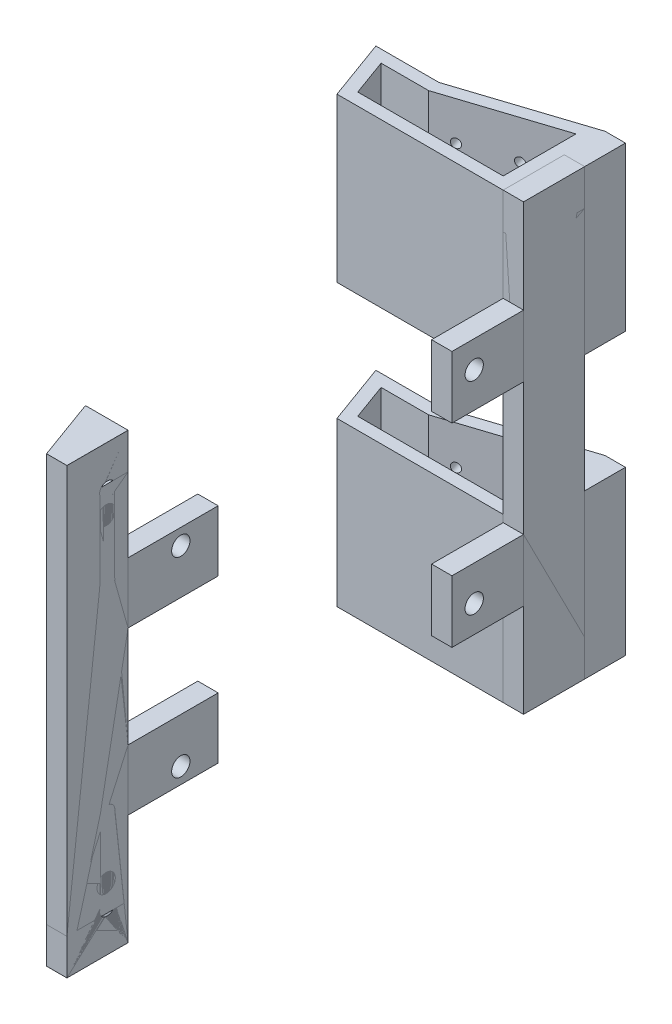
from build123d import *

# Parameters (mm, degrees)
SKETCH1_W           = 100
SKETCH1_H           = 15
SKETCH1_R           = 2.25
SKETCH1_W_2         = 14.921299074
SKETCH1_H_2         = 22.105793739
SKETCH1_W_3         = 70.661870142
SKETCH1_W_4         = 15.23025044
SKETCH1_H_3         = 17.565251106
SKETCH1_W_5         = 14.107879418
BOSS_EXTRUDE1_DEPTH = 5
BOSS_EXTRUDE2_START = -40
BOSS_EXTRUDE2_DEPTH = 40
SKETCH3_W           = 5
SKETCH3_H           = 10
BOSS_EXTRUDE3_DEPTH = 40
CUT_EXTRUDE1_DEPTH  = 40
SKETCH5_R           = 1.75
CUT_EXTRUDE2_DEPTH  = 40
SKETCH6_R           = 1.75
CUT_EXTRUDE3_DEPTH  = 5
SKETCH8_R           = 1.1
CUT_EXTRUDE4_DEPTH  = 5


# Read off the part's stored shape, not the designer's step: Boss-Extrude2
with BuildPart() as part:
    # Sketch1 → Boss-Extrude1 (new body)
    # profile 1 of 6: a face of its own
    with BuildSketch(Plane(origin=(0, 0, 0), x_dir=(0, -1, 0), z_dir=(1, 0, 0))):
        with Locations((4.410178483, -178.601306164)):
            Rectangle(SKETCH1_W, SKETCH1_H)
        with Locations(Location((-39.077814949, -176.473432316, 0), (0, 0, 90))):
            Circle(SKETCH1_R, mode=Mode.SUBTRACT)
    # profile 2 of 6: a face of its own
    with BuildSketch(Plane(origin=(0, 0, 0), x_dir=(0, -1, 0), z_dir=(1, 0, 0))):
        with Locations((-19.877693347, -160.048409295)):
            Rectangle(SKETCH1_W_2, SKETCH1_H_2)
        with Locations(Location((-23.429285294, -158.167053109, 0), (0, 0, 90))):
            Circle(SKETCH1_R, mode=Mode.SUBTRACT)
    # profile 3 of 6: a face of its own
    with BuildSketch(Plane(origin=(0, 0, 0), x_dir=(0, -1, 0), z_dir=(1, 0, 0))):
        with Locations((19.115108312, -66.576805734)):
            Rectangle(SKETCH1_W_3, SKETCH1_H)
    # profile 4 of 6: a face of its own
    with BuildSketch(Plane(origin=(0, 0, 0), x_dir=(0, -1, 0), z_dir=(1, 0, 0))):
        with Locations((-23.830951979, -82.859431287)):
            Rectangle(SKETCH1_W_4, SKETCH1_H_3)
        with Locations(Location((-24.823172215, -86.180546879, 0), (0, 0, 90))):
            Circle(SKETCH1_R, mode=Mode.SUBTRACT)
    # profile 5 of 6: a face of its own
    with BuildSketch(Plane(origin=(0, 0, 0), x_dir=(0, -1, 0), z_dir=(1, 0, 0))):
        with Locations((-23.830951979, -66.576805734)):
            Rectangle(SKETCH1_W_4, SKETCH1_H)
    # profile 6 of 6: a face of its own
    with BuildSketch(Plane(origin=(0, 0, 0), x_dir=(0, -1, 0), z_dir=(1, 0, 0))):
        with Locations((-38.500016908, -66.576805734)):
            Rectangle(SKETCH1_W_5, SKETCH1_H)
        with Locations(Location((-41.168645329, -68.49367297, 0), (0, 0, 90))):
            Circle(SKETCH1_R, mode=Mode.SUBTRACT)
    extrude(amount=BOSS_EXTRUDE1_DEPTH)


with BuildPart() as body_2:
    # Boss-Extrude2 outline → Boss-Extrude2 (new body)
    with BuildSketch(Plane(origin=(0, 45.553956617, 0), x_dir=(-1, 0, 0), z_dir=(0, 1, 0)).offset(BOSS_EXTRUDE2_START)):
        Polygon((0, 59.076805734), (46.233137179, 59.076805734), (40.773583665, 74.076805734), (0, 74.076805734), align=None)
        Polygon((-5, 186.101306164), (-5, 171.101306164), (5.459553514, 171.101306164), (0, 186.101306164), align=None)
    extrude(amount=BOSS_EXTRUDE2_DEPTH)

    # Sketch3 → Boss-Extrude3 (add)
    with BuildSketch(Plane(origin=(0, 45.553956617, 0), x_dir=(-1, 0, 0), z_dir=(0, 1, 0))):
        Polygon((30.776835372, 59.076805734), (0, 59.076805734), (0, 49.076805734), align=None)
        with Locations((-2.5, 54.076805734)):
            Rectangle(SKETCH3_W, SKETCH3_H)
    extrude(amount=-BOSS_EXTRUDE3_DEPTH)

    # Sketch4 → Cut-Extrude1 (cut)
    with BuildSketch(Plane(origin=(0, 45.553956617, 0), x_dir=(-1, 0, 0), z_dir=(0, 1, 0))):
        Polygon((30.301682051, 62.076805734), (3, 53.205951496), (3, 71.076805734), (38.67296105, 71.076805734), (41.948693159, 62.076805734), align=None)
    extrude(amount=-CUT_EXTRUDE1_DEPTH, mode=Mode.SUBTRACT)


with BuildPart() as body_2_1:
    # Body-Move/Copy1: moved
    add(body_2.part.moved(Location((0, -60, 0))))


with BuildPart() as cut_extrude2_tool:
    # Sketch5 → Cut-Extrude2 (new body)
    with BuildSketch(Plane(origin=(-59.811806874, 0, 21.76971736), x_dir=(0, -1, 0), z_dir=(-0.9396926207859104, 0, 0.34202014332566316))):
        with Locations(Location((24.446043383, 167.301662499, 0), (0, 0, 90))):
            Circle(SKETCH5_R)
        with Locations(Location((44.446043383, 167.301662499, 0), (0, 0, 90))):
            Circle(SKETCH5_R)
    extrude(amount=-CUT_EXTRUDE2_DEPTH)


with BuildPart() as part_1:
    add(part.part)

    # Cut-Extrude2: cut by cut_extrude2_tool
    add(cut_extrude2_tool.part, mode=Mode.SUBTRACT)


with BuildPart() as body_2_2:
    add(body_2_1.part)

    # Cut-Extrude2: cut by cut_extrude2_tool
    add(cut_extrude2_tool.part, mode=Mode.SUBTRACT)

    # Sketch6 → Cut-Extrude3 (cut)
    with BuildSketch(Plane(origin=(-59.811806874, 0, 21.76971736), x_dir=(0, -1, 0), z_dir=(-0.9396926207859104, 0, 0.34202014332566316))):
        with Locations(Location((24.446043383, 48.162329344, 0), (0, 0, 90))):
            Circle(SKETCH6_R)
        with Locations(Location((44.446043383, 48.162329344, 0), (0, 0, 90))):
            Circle(SKETCH6_R)
    extrude(amount=-CUT_EXTRUDE3_DEPTH, mode=Mode.SUBTRACT)

    # Sketch8 → Cut-Extrude4 (cut)
    with BuildSketch(Plane(origin=(14.42331132, 0, 44.390387801), x_dir=(0.9510565162951521, 0, -0.309016994374952), z_dir=(-0.309016994374952, 0, -0.9510565162951521))):
        with Locations(Location((-42.665567001, 23.946043383, 0), (0, 0, 180))):
            Circle(SKETCH8_R)
        with Locations(Location((-30.165567001, 23.946043383, 0), (0, 0, 180))):
            Circle(SKETCH8_R)
        with Locations(Location((-42.665567001, 44.946043383, 0), (0, 0, 180))):
            Circle(SKETCH8_R)
        with Locations(Location((-30.165567001, 44.946043383, 0), (0, 0, 180))):
            Circle(SKETCH8_R)
    extrude(amount=-CUT_EXTRUDE4_DEPTH, mode=Mode.SUBTRACT)


with BuildPart() as body_3:
    # Mirror1: mirrored copy
    add(part_1.part.mirror(Plane.ZX))


with BuildPart() as body_4:
    # Mirror1 2: mirrored copy
    add(body_2_2.part.mirror(Plane.ZX))


solid = Compound([part_1.part, body_2_2.part, body_3.part, body_4.part])
